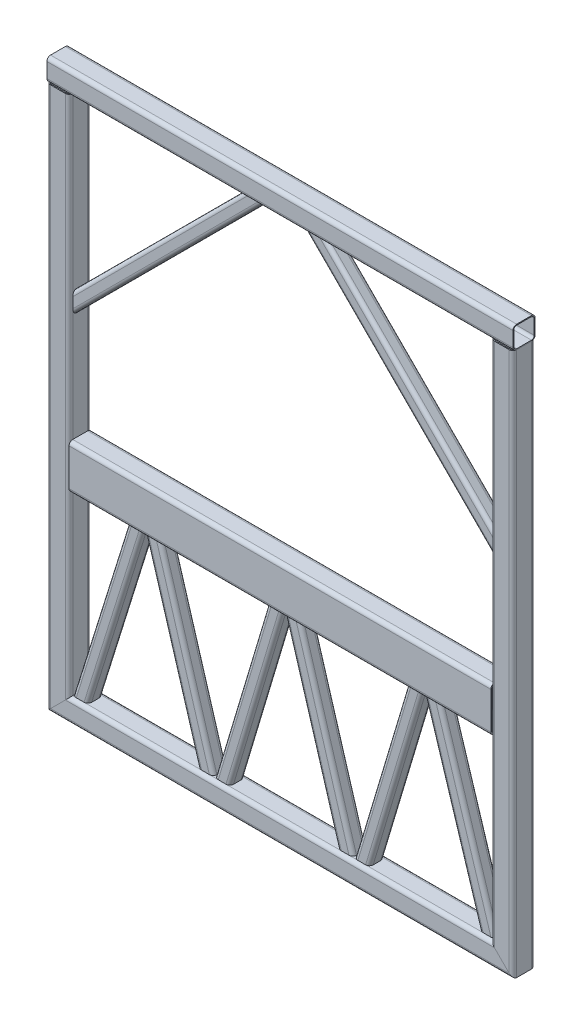
from build123d import *

# Parameters (mm, degrees)
VERTICAL_MEMBERS_DEPTH                 = 1828.8
VERTICAL_MEMBERS_2_DEPTH               = 1828.8
DECK_DEPTH                             = 1524
BOTTOM_DEPTH                           = 1524
TRUSS_1_DEPTH                          = 638.672380803
TRUSS_1_2_DEPTH                        = 638.672380803
TRUSS_2_DEPTH                          = 636.349924496
TRUSS_2_2_DEPTH                        = 636.349924496
TRUSS_3_DEPTH                          = 636.349924496
TRUSS_3_2_DEPTH                        = 636.349924496
TRUSS_TRIM_EXTEND_1_RUN_ON             = 7.9375
TRUSS_TRIM_EXTEND_1_OTHER_END_RUN_ON   = 317.510027
TRUSS_TRIM_EXTEND_2_RUN_ON             = 277.664177
TRUSS_TRIM_EXTEND_2_OTHER_END_RUN_ON   = 30.608782
TRUSS_TRIM_EXTEND_3_RUN_ON             = 168.151073
TRUSS_TRIM_EXTEND_3_OTHER_END_RUN_ON   = 140.121886
TRUSS_TRIM_EXTEND_4_RUN_ON             = 140.121886
TRUSS_TRIM_EXTEND_4_OTHER_END_RUN_ON   = 168.151073
TRUSS_TRIM_EXTEND_5_RUN_ON             = 277.664177
TRUSS_TRIM_EXTEND_5_OTHER_END_RUN_ON   = 30.608782
TRUSS_TRIM_EXTEND_6_RUN_ON             = 317.510026
TRUSS_TRIM_EXTEND_6_OTHER_END_RUN_ON   = 7.9375
BODY_START                             = 1613.273853094
BODY_2_RUN_ON_DEPTH                    = 253.626146906
BODY_START_2                           = 1308.473853094
BODY_4_RUN_ON_DEPTH                    = 253.626146906
PART_START                             = 1613.273853094
PART_RUN_ON_DEPTH                      = 253.626146906
BODY_START_3                           = 215.526146906
BODY_4_RUN_ON_2_DEPTH                  = 253.626146906
STRUCTURAL_MEMBER1_DEPTH               = 1524
BODY_11_RUN_ON_DEPTH                   = 253.626146906
BODY_11_RUN_ON_2_DEPTH                 = 253.626146906
STRUCTURAL_MEMBER2_DEPTH               = 880.065099865
STRUCTURAL_MEMBER2_2_DEPTH             = 880.065099865
TRIM_EXTEND3_EXTEND_1_RUN_ON           = 933.946637
TRIM_EXTEND3_EXTEND_1_OTHER_END_RUN_ON = 691.479721
TRIM_EXTEND4_EXTEND_1_RUN_ON           = 933.946637
TRIM_EXTEND4_EXTEND_1_OTHER_END_RUN_ON = 691.479721


with BuildPart() as part:
    # Sketch111 → Vertical Members (new body)
    with BuildSketch(Plane.XZ.offset(-1828.8)):
        with BuildLine():
            Line((-25.4, -38.1), (25.4, -38.1))
            ThreePointArc((25.4, -38.1), (34.380256121, -34.380256121), (38.1, -25.4))
            Line((38.1, -25.4), (38.1, 25.4))
            ThreePointArc((38.1, 25.4), (34.380256121, 34.380256121), (25.4, 38.1))
            Line((25.4, 38.1), (-25.4, 38.1))
            ThreePointArc((-25.4, 38.1), (-34.380256121, 34.380256121), (-38.1, 25.4))
            Line((-38.1, 25.4), (-38.1, -25.4))
            ThreePointArc((-38.1, -25.4), (-34.380256121, -34.380256121), (-25.4, -38.1))
        make_face()
        with BuildLine():
            Line((-25.4, -34.925), (25.4, -34.925))
            ThreePointArc((25.4, -34.925), (32.135192091, -32.135192091), (34.925, -25.4))
            Line((34.925, -25.4), (34.925, 25.4))
            ThreePointArc((34.925, 25.4), (32.135192091, 32.135192091), (25.4, 34.925))
            Line((25.4, 34.925), (-25.4, 34.925))
            ThreePointArc((-25.4, 34.925), (-32.135192091, 32.135192091), (-34.925, 25.4))
            Line((-34.925, 25.4), (-34.925, -25.4))
            ThreePointArc((-34.925, -25.4), (-32.135192091, -32.135192091), (-25.4, -34.925))
        make_face(mode=Mode.SUBTRACT)
    extrude(amount=VERTICAL_MEMBERS_DEPTH)

    # part cut square before the run-on
    split(bisect_by=Plane(origin=(0, 215.526146906, 0), x_dir=(-1, 0, 0), z_dir=(0, 1, 0)), keep=Keep.TOP)

    # Sketch111 → part run on (add)
    with BuildSketch(Plane.XZ.offset(-1828.8).offset(PART_START)):
        with BuildLine():
            Line((-25.4, -38.1), (25.4, -38.1))
            ThreePointArc((25.4, -38.1), (34.380256121, -34.380256121), (38.1, -25.4))
            Line((38.1, -25.4), (38.1, 25.4))
            ThreePointArc((38.1, 25.4), (34.380256121, 34.380256121), (25.4, 38.1))
            Line((25.4, 38.1), (-25.4, 38.1))
            ThreePointArc((-25.4, 38.1), (-34.380256121, 34.380256121), (-38.1, 25.4))
            Line((-38.1, 25.4), (-38.1, -25.4))
            ThreePointArc((-38.1, -25.4), (-34.380256121, -34.380256121), (-25.4, -38.1))
        make_face()
        with BuildLine():
            Line((-25.4, -34.925), (25.4, -34.925))
            ThreePointArc((25.4, -34.925), (32.135192091, -32.135192091), (34.925, -25.4))
            Line((34.925, -25.4), (34.925, 25.4))
            ThreePointArc((34.925, 25.4), (32.135192091, 32.135192091), (25.4, 34.925))
            Line((25.4, 34.925), (-25.4, 34.925))
            ThreePointArc((-25.4, 34.925), (-32.135192091, 32.135192091), (-34.925, 25.4))
            Line((-34.925, 25.4), (-34.925, -25.4))
            ThreePointArc((-34.925, -25.4), (-32.135192091, -32.135192091), (-25.4, -34.925))
        make_face(mode=Mode.SUBTRACT)
    extrude(amount=PART_RUN_ON_DEPTH)

    # Bottom miter 2
    split(bisect_by=Plane(origin=(0, 0, 0), x_dir=(-0.707106781, -0.707106781, 0), z_dir=(-0.707106781, 0.707106781, 0)), keep=Keep.TOP)


with BuildPart() as body_2:
    # Sketch111 on segment 2 (carried to segment 2) → Vertical Members 2 (new body)
    with BuildSketch(Plane(origin=(1524, 1828.8, 0), x_dir=(1, 0, 0), z_dir=(0, -1, 0))):
        with BuildLine():
            Line((-25.4, -38.1), (25.4, -38.1))
            ThreePointArc((25.4, -38.1), (34.380256121, -34.380256121), (38.1, -25.4))
            Line((38.1, -25.4), (38.1, 25.4))
            ThreePointArc((38.1, 25.4), (34.380256121, 34.380256121), (25.4, 38.1))
            Line((25.4, 38.1), (-25.4, 38.1))
            ThreePointArc((-25.4, 38.1), (-34.380256121, 34.380256121), (-38.1, 25.4))
            Line((-38.1, 25.4), (-38.1, -25.4))
            ThreePointArc((-38.1, -25.4), (-34.380256121, -34.380256121), (-25.4, -38.1))
        make_face()
        with BuildLine():
            Line((-25.4, -34.925), (25.4, -34.925))
            ThreePointArc((25.4, -34.925), (32.135192091, -32.135192091), (34.925, -25.4))
            Line((34.925, -25.4), (34.925, 25.4))
            ThreePointArc((34.925, 25.4), (32.135192091, 32.135192091), (25.4, 34.925))
            Line((25.4, 34.925), (-25.4, 34.925))
            ThreePointArc((-25.4, 34.925), (-32.135192091, 32.135192091), (-34.925, 25.4))
            Line((-34.925, 25.4), (-34.925, -25.4))
            ThreePointArc((-34.925, -25.4), (-32.135192091, -32.135192091), (-25.4, -34.925))
        make_face(mode=Mode.SUBTRACT)
    extrude(amount=VERTICAL_MEMBERS_2_DEPTH)

    # body 2 cut square before the run-on
    split(bisect_by=Plane(origin=(1524, 215.526146906, 0), x_dir=(-1, 0, 0), z_dir=(0, 1, 0)), keep=Keep.TOP)

    # Sketch111 on segment 2 (carried to segment 2) → body 2 run on (add)
    with BuildSketch(Plane(origin=(1524, 1828.8, 0), x_dir=(1, 0, 0), z_dir=(0, -1, 0)).offset(BODY_START)):
        with BuildLine():
            Line((-25.4, -38.1), (25.4, -38.1))
            ThreePointArc((25.4, -38.1), (34.380256121, -34.380256121), (38.1, -25.4))
            Line((38.1, -25.4), (38.1, 25.4))
            ThreePointArc((38.1, 25.4), (34.380256121, 34.380256121), (25.4, 38.1))
            Line((25.4, 38.1), (-25.4, 38.1))
            ThreePointArc((-25.4, 38.1), (-34.380256121, 34.380256121), (-38.1, 25.4))
            Line((-38.1, 25.4), (-38.1, -25.4))
            ThreePointArc((-38.1, -25.4), (-34.380256121, -34.380256121), (-25.4, -38.1))
        make_face()
        with BuildLine():
            Line((-25.4, -34.925), (25.4, -34.925))
            ThreePointArc((25.4, -34.925), (32.135192091, -32.135192091), (34.925, -25.4))
            Line((34.925, -25.4), (34.925, 25.4))
            ThreePointArc((34.925, 25.4), (32.135192091, 32.135192091), (25.4, 34.925))
            Line((25.4, 34.925), (-25.4, 34.925))
            ThreePointArc((-25.4, 34.925), (-32.135192091, 32.135192091), (-34.925, 25.4))
            Line((-34.925, 25.4), (-34.925, -25.4))
            ThreePointArc((-34.925, -25.4), (-32.135192091, -32.135192091), (-25.4, -34.925))
        make_face(mode=Mode.SUBTRACT)
    extrude(amount=BODY_2_RUN_ON_DEPTH)

    # Bottom miter 1
    split(bisect_by=Plane(origin=(1524, 0, 0), x_dir=(-0.707106781, 0.707106781, 0), z_dir=(0.707106781, 0.707106781, 0)), keep=Keep.TOP)


with BuildPart() as body_3:
    # Sketch115 → Deck (new body)
    with BuildSketch(Plane(origin=(0, 723.9, 0), x_dir=(0, 1, 0), z_dir=(1, 0, 0))):
        with BuildLine():
            Line((-63.5, -38.1), (63.5, -38.1))
            ThreePointArc((63.5, -38.1), (72.480256121, -34.380256121), (76.2, -25.4))
            Line((76.2, -25.4), (76.2, 25.4))
            ThreePointArc((76.2, 25.4), (72.480256121, 34.380256121), (63.5, 38.1))
            Line((63.5, 38.1), (-63.5, 38.1))
            ThreePointArc((-63.5, 38.1), (-72.480256121, 34.380256121), (-76.2, 25.4))
            Line((-76.2, 25.4), (-76.2, -25.4))
            ThreePointArc((-76.2, -25.4), (-72.480256121, -34.380256121), (-63.5, -38.1))
        make_face()
        with BuildLine():
            Line((-63.5, -33.3375), (63.5, -33.3375))
            ThreePointArc((63.5, -33.3375), (69.112660076, -31.012660076), (71.4375, -25.4))
            Line((71.4375, -25.4), (71.4375, 25.4))
            ThreePointArc((71.4375, 25.4), (69.112660076, 31.012660076), (63.5, 33.3375))
            Line((63.5, 33.3375), (-63.5, 33.3375))
            ThreePointArc((-63.5, 33.3375), (-69.112660076, 31.012660076), (-71.4375, 25.4))
            Line((-71.4375, 25.4), (-71.4375, -25.4))
            ThreePointArc((-71.4375, -25.4), (-69.112660076, -31.012660076), (-63.5, -33.3375))
        make_face(mode=Mode.SUBTRACT)
    extrude(amount=DECK_DEPTH)

    # Deck trim 43
    split(bisect_by=Plane(origin=(1485.9, 0, 0), x_dir=(0, -1, 0), z_dir=(-1, 0, 0)), keep=Keep.TOP)

    # Deck trim 86
    split(bisect_by=Plane.YZ.offset(38.1), keep=Keep.TOP)


with BuildPart() as body_4:
    # Sketch122 → Bottom (new body)
    with BuildSketch(Plane.YZ):
        with BuildLine():
            Line((-25.4, -38.1), (25.4, -38.1))
            ThreePointArc((25.4, -38.1), (34.380256121, -34.380256121), (38.1, -25.4))
            Line((38.1, -25.4), (38.1, 25.4))
            ThreePointArc((38.1, 25.4), (34.380256121, 34.380256121), (25.4, 38.1))
            Line((25.4, 38.1), (-25.4, 38.1))
            ThreePointArc((-25.4, 38.1), (-34.380256121, 34.380256121), (-38.1, 25.4))
            Line((-38.1, 25.4), (-38.1, -25.4))
            ThreePointArc((-38.1, -25.4), (-34.380256121, -34.380256121), (-25.4, -38.1))
        make_face()
        with BuildLine():
            Line((-25.4, -34.925), (25.4, -34.925))
            ThreePointArc((25.4, -34.925), (32.135192091, -32.135192091), (34.925, -25.4))
            Line((34.925, -25.4), (34.925, 25.4))
            ThreePointArc((34.925, 25.4), (32.135192091, 32.135192091), (25.4, 34.925))
            Line((25.4, 34.925), (-25.4, 34.925))
            ThreePointArc((-25.4, 34.925), (-32.135192091, 32.135192091), (-34.925, 25.4))
            Line((-34.925, 25.4), (-34.925, -25.4))
            ThreePointArc((-34.925, -25.4), (-32.135192091, -32.135192091), (-25.4, -34.925))
        make_face(mode=Mode.SUBTRACT)
    extrude(amount=BOTTOM_DEPTH)

    # body 4 cut square before the run-on
    split(bisect_by=Plane(origin=(1308.473853094, 0, 0), x_dir=(0, -1, 0), z_dir=(-1, 0, 0)), keep=Keep.TOP)

    # Sketch122 → body 4 run on (add)
    with BuildSketch(Plane.YZ.offset(BODY_START_2)):
        with BuildLine():
            Line((-25.4, -38.1), (25.4, -38.1))
            ThreePointArc((25.4, -38.1), (34.380256121, -34.380256121), (38.1, -25.4))
            Line((38.1, -25.4), (38.1, 25.4))
            ThreePointArc((38.1, 25.4), (34.380256121, 34.380256121), (25.4, 38.1))
            Line((25.4, 38.1), (-25.4, 38.1))
            ThreePointArc((-25.4, 38.1), (-34.380256121, 34.380256121), (-38.1, 25.4))
            Line((-38.1, 25.4), (-38.1, -25.4))
            ThreePointArc((-38.1, -25.4), (-34.380256121, -34.380256121), (-25.4, -38.1))
        make_face()
        with BuildLine():
            Line((-25.4, -34.925), (25.4, -34.925))
            ThreePointArc((25.4, -34.925), (32.135192091, -32.135192091), (34.925, -25.4))
            Line((34.925, -25.4), (34.925, 25.4))
            ThreePointArc((34.925, 25.4), (32.135192091, 32.135192091), (25.4, 34.925))
            Line((25.4, 34.925), (-25.4, 34.925))
            ThreePointArc((-25.4, 34.925), (-32.135192091, 32.135192091), (-34.925, 25.4))
            Line((-34.925, 25.4), (-34.925, -25.4))
            ThreePointArc((-34.925, -25.4), (-32.135192091, -32.135192091), (-25.4, -34.925))
        make_face(mode=Mode.SUBTRACT)
    extrude(amount=BODY_4_RUN_ON_DEPTH)

    # Bottom miter 1
    split(bisect_by=Plane(origin=(1524, 0, 0), x_dir=(0.707106781, -0.707106781, 0), z_dir=(-0.707106781, -0.707106781, 0)), keep=Keep.TOP)

    # body 4 cut square before the run-on
    split(bisect_by=Plane.YZ.offset(215.526146906), keep=Keep.TOP)

    # Sketch122 → body 4 run on 2 (add)
    with BuildSketch(Plane.YZ.offset(BODY_START_3)):
        with BuildLine():
            Line((-25.4, -38.1), (25.4, -38.1))
            ThreePointArc((25.4, -38.1), (34.380256121, -34.380256121), (38.1, -25.4))
            Line((38.1, -25.4), (38.1, 25.4))
            ThreePointArc((38.1, 25.4), (34.380256121, 34.380256121), (25.4, 38.1))
            Line((25.4, 38.1), (-25.4, 38.1))
            ThreePointArc((-25.4, 38.1), (-34.380256121, 34.380256121), (-38.1, 25.4))
            Line((-38.1, 25.4), (-38.1, -25.4))
            ThreePointArc((-38.1, -25.4), (-34.380256121, -34.380256121), (-25.4, -38.1))
        make_face()
        with BuildLine():
            Line((-25.4, -34.925), (25.4, -34.925))
            ThreePointArc((25.4, -34.925), (32.135192091, -32.135192091), (34.925, -25.4))
            Line((34.925, -25.4), (34.925, 25.4))
            ThreePointArc((34.925, 25.4), (32.135192091, 32.135192091), (25.4, 34.925))
            Line((25.4, 34.925), (-25.4, 34.925))
            ThreePointArc((-25.4, 34.925), (-32.135192091, 32.135192091), (-34.925, 25.4))
            Line((-34.925, 25.4), (-34.925, -25.4))
            ThreePointArc((-34.925, -25.4), (-32.135192091, -32.135192091), (-25.4, -34.925))
        make_face(mode=Mode.SUBTRACT)
    extrude(amount=-BODY_4_RUN_ON_2_DEPTH)

    # Bottom miter 2
    split(bisect_by=Plane(origin=(0, 0, 0), x_dir=(0.707106781, 0.707106781, 0), z_dir=(0.707106781, -0.707106781, 0)), keep=Keep.TOP)


with BuildPart() as body_5:
    # Sketch114 → Truss 1 (new body)
    with BuildSketch(Plane(origin=(254, 647.7, 0), x_dir=(0.9544799780350298, -0.29827499313594713, 0), z_dir=(-0.29827499313594713, -0.9544799780350298, 0))):
        with BuildLine():
            Line((-12.7, -25.4), (12.7, -25.4))
            ThreePointArc((12.7, -25.4), (21.680256121, -21.680256121), (25.4, -12.7))
            Line((25.4, -12.7), (25.4, 12.7))
            ThreePointArc((25.4, 12.7), (21.680256121, 21.680256121), (12.7, 25.4))
            Line((12.7, 25.4), (-12.7, 25.4))
            ThreePointArc((-12.7, 25.4), (-21.680256121, 21.680256121), (-25.4, 12.7))
            Line((-25.4, 12.7), (-25.4, -12.7))
            ThreePointArc((-25.4, -12.7), (-21.680256121, -21.680256121), (-12.7, -25.4))
        make_face()
        with BuildLine():
            Line((-12.7, -22.225), (12.7, -22.225))
            ThreePointArc((12.7, -22.225), (19.435192091, -19.435192091), (22.225, -12.7))
            Line((22.225, -12.7), (22.225, 12.7))
            ThreePointArc((22.225, 12.7), (19.435192091, 19.435192091), (12.7, 22.225))
            Line((12.7, 22.225), (-12.7, 22.225))
            ThreePointArc((-12.7, 22.225), (-19.435192091, 19.435192091), (-22.225, 12.7))
            Line((-22.225, 12.7), (-22.225, -12.7))
            ThreePointArc((-22.225, -12.7), (-19.435192091, -19.435192091), (-12.7, -22.225))
        make_face(mode=Mode.SUBTRACT)
    extrude(amount=TRUSS_1_DEPTH)

    # Truss Trim extend 1: the member runs on so that the trim can cut it back to the boundary (SolidWorks' 'allow extension')
    extrude(body_5.faces().sort_by_distance((44.104966846, 44.16094786, -20.32))[0], amount=TRUSS_TRIM_EXTEND_1_RUN_ON, dir=(-0.298274993, -0.954479978, 0))

    # Truss Trim extend 1 other end: the member runs on so that the trim can cut it back to the boundary (SolidWorks' 'allow extension')
    extrude(body_5.faces().sort_by_distance((234.604966846, 653.760947861, -20.32))[0], amount=TRUSS_TRIM_EXTEND_1_OTHER_END_RUN_ON, dir=(0.298274993, 0.954479978, 0))

    # Truss Trim
    split(bisect_by=Plane(origin=(762, 647.7, 0), x_dir=(1, 0, 0), z_dir=(0, -1, 0)), keep=Keep.TOP)

    # Truss Trim 3
    split(bisect_by=Plane(origin=(762, 38.1, 0), x_dir=(-1, 0, 0), z_dir=(0, 1, 0)), keep=Keep.TOP)


with BuildPart() as body_6:
    # Sketch114 on segment 2 (carried to segment 2) → Truss 1 2 (new body)
    with BuildSketch(Plane(origin=(1460.5, 38.1, 0), x_dir=(-0.954479978, -0.298274993, 0), z_dir=(-0.298274993, 0.954479978, 0))):
        with BuildLine():
            Line((-12.7, -25.4), (12.7, -25.4))
            ThreePointArc((12.7, -25.4), (21.680256121, -21.680256121), (25.4, -12.7))
            Line((25.4, -12.7), (25.4, 12.7))
            ThreePointArc((25.4, 12.7), (21.680256121, 21.680256121), (12.7, 25.4))
            Line((12.7, 25.4), (-12.7, 25.4))
            ThreePointArc((-12.7, 25.4), (-21.680256121, 21.680256121), (-25.4, 12.7))
            Line((-25.4, 12.7), (-25.4, -12.7))
            ThreePointArc((-25.4, -12.7), (-21.680256121, -21.680256121), (-12.7, -25.4))
        make_face()
        with BuildLine():
            Line((-12.7, -22.225), (12.7, -22.225))
            ThreePointArc((12.7, -22.225), (19.435192091, -19.435192091), (22.225, -12.7))
            Line((22.225, -12.7), (22.225, 12.7))
            ThreePointArc((22.225, 12.7), (19.435192091, 19.435192091), (12.7, 22.225))
            Line((12.7, 22.225), (-12.7, 22.225))
            ThreePointArc((-12.7, 22.225), (-19.435192091, 19.435192091), (-22.225, 12.7))
            Line((-22.225, 12.7), (-22.225, -12.7))
            ThreePointArc((-22.225, -12.7), (-19.435192091, -19.435192091), (-12.7, -22.225))
        make_face(mode=Mode.SUBTRACT)
    extrude(amount=TRUSS_1_2_DEPTH)

    # Truss Trim extend 6: the member runs on so that the trim can cut it back to the boundary (SolidWorks' 'allow extension')
    extrude(body_6.faces().sort_by_distance((1289.395033227, 653.760947881, -20.32))[0], amount=TRUSS_TRIM_EXTEND_6_RUN_ON, dir=(-0.298274993, 0.954479978, 0))

    # Truss Trim extend 6 other end: the member runs on so that the trim can cut it back to the boundary (SolidWorks' 'allow extension')
    extrude(body_6.faces().sort_by_distance((1479.895033154, 44.160947858, -20.32))[0], amount=TRUSS_TRIM_EXTEND_6_OTHER_END_RUN_ON, dir=(0.298274993, -0.954479978, 0))

    # Truss Trim
    split(bisect_by=Plane(origin=(762, 647.7, 0), x_dir=(1, 0, 0), z_dir=(0, -1, 0)), keep=Keep.TOP)

    # Truss Trim 3
    split(bisect_by=Plane(origin=(762, 38.1, 0), x_dir=(-1, 0, 0), z_dir=(0, 1, 0)), keep=Keep.TOP)


with BuildPart() as body_7:
    # Sketch118 → Truss 2 (new body)
    with BuildSketch(Plane(origin=(311.15, 647.7, 0), x_dir=(0.9579634985934418, 0.2868901102558484, 0), z_dir=(0.2868901102558484, -0.9579634985934419, 0))):
        with BuildLine():
            Line((-12.7, -25.4), (12.7, -25.4))
            ThreePointArc((12.7, -25.4), (21.680256121, -21.680256121), (25.4, -12.7))
            Line((25.4, -12.7), (25.4, 12.7))
            ThreePointArc((25.4, 12.7), (21.680256121, 21.680256121), (12.7, 25.4))
            Line((12.7, 25.4), (-12.7, 25.4))
            ThreePointArc((-12.7, 25.4), (-21.680256121, 21.680256121), (-25.4, 12.7))
            Line((-25.4, 12.7), (-25.4, -12.7))
            ThreePointArc((-25.4, -12.7), (-21.680256121, -21.680256121), (-12.7, -25.4))
        make_face()
        with BuildLine():
            Line((-12.7, -22.225), (12.7, -22.225))
            ThreePointArc((12.7, -22.225), (19.435192091, -19.435192091), (22.225, -12.7))
            Line((22.225, -12.7), (22.225, 12.7))
            ThreePointArc((22.225, 12.7), (19.435192091, 19.435192091), (12.7, 22.225))
            Line((12.7, 22.225), (-12.7, 22.225))
            ThreePointArc((-12.7, 22.225), (-19.435192091, 19.435192091), (-22.225, 12.7))
            Line((-22.225, 12.7), (-22.225, -12.7))
            ThreePointArc((-22.225, -12.7), (-19.435192091, -19.435192091), (-12.7, -22.225))
        make_face(mode=Mode.SUBTRACT)
    extrude(amount=TRUSS_2_DEPTH)

    # Truss Trim extend 2: the member runs on so that the trim can cut it back to the boundary (SolidWorks' 'allow extension')
    extrude(body_7.faces().sort_by_distance((474.246681709, 32.27039296, -20.32))[0], amount=TRUSS_TRIM_EXTEND_2_RUN_ON, dir=(0.28689011, -0.957963499, 0))

    # Truss Trim extend 2 other end: the member runs on so that the trim can cut it back to the boundary (SolidWorks' 'allow extension')
    extrude(body_7.faces().sort_by_distance((291.684181709, 641.87039296, -20.32))[0], amount=TRUSS_TRIM_EXTEND_2_OTHER_END_RUN_ON, dir=(-0.28689011, 0.957963499, 0))

    # Truss Trim
    split(bisect_by=Plane(origin=(762, 647.7, 0), x_dir=(1, 0, 0), z_dir=(0, -1, 0)), keep=Keep.TOP)

    # Truss Trim 3
    split(bisect_by=Plane(origin=(762, 38.1, 0), x_dir=(-1, 0, 0), z_dir=(0, 1, 0)), keep=Keep.TOP)


with BuildPart() as body_8:
    # Sketch118 on segment 2 (carried to segment 2) → Truss 2 2 (new body)
    with BuildSketch(Plane(origin=(1212.85, 647.7, 0), x_dir=(0.957963499, -0.28689011, 0), z_dir=(-0.28689011, -0.957963499, 0))):
        with BuildLine():
            Line((-12.7, -25.4), (12.7, -25.4))
            ThreePointArc((12.7, -25.4), (21.680256121, -21.680256121), (25.4, -12.7))
            Line((25.4, -12.7), (25.4, 12.7))
            ThreePointArc((25.4, 12.7), (21.680256121, 21.680256121), (12.7, 25.4))
            Line((12.7, 25.4), (-12.7, 25.4))
            ThreePointArc((-12.7, 25.4), (-21.680256121, 21.680256121), (-25.4, 12.7))
            Line((-25.4, 12.7), (-25.4, -12.7))
            ThreePointArc((-25.4, -12.7), (-21.680256121, -21.680256121), (-12.7, -25.4))
        make_face()
        with BuildLine():
            Line((-12.7, -22.225), (12.7, -22.225))
            ThreePointArc((12.7, -22.225), (19.435192091, -19.435192091), (22.225, -12.7))
            Line((22.225, -12.7), (22.225, 12.7))
            ThreePointArc((22.225, 12.7), (19.435192091, 19.435192091), (12.7, 22.225))
            Line((12.7, 22.225), (-12.7, 22.225))
            ThreePointArc((-12.7, 22.225), (-19.435192091, 19.435192091), (-22.225, 12.7))
            Line((-22.225, 12.7), (-22.225, -12.7))
            ThreePointArc((-22.225, -12.7), (-19.435192091, -19.435192091), (-12.7, -22.225))
        make_face(mode=Mode.SUBTRACT)
    extrude(amount=TRUSS_2_2_DEPTH)

    # Truss Trim extend 5: the member runs on so that the trim can cut it back to the boundary (SolidWorks' 'allow extension')
    extrude(body_8.faces().sort_by_distance((1010.821681927, 43.929606967, -20.32))[0], amount=TRUSS_TRIM_EXTEND_5_RUN_ON, dir=(-0.28689011, -0.957963499, 0))

    # Truss Trim extend 5 other end: the member runs on so that the trim can cut it back to the boundary (SolidWorks' 'allow extension')
    extrude(body_8.faces().sort_by_distance((1193.384181706, 653.529607033, -20.32))[0], amount=TRUSS_TRIM_EXTEND_5_OTHER_END_RUN_ON, dir=(0.28689011, 0.957963499, 0))

    # Truss Trim
    split(bisect_by=Plane(origin=(762, 647.7, 0), x_dir=(1, 0, 0), z_dir=(0, -1, 0)), keep=Keep.TOP)

    # Truss Trim 3
    split(bisect_by=Plane(origin=(762, 38.1, 0), x_dir=(-1, 0, 0), z_dir=(0, 1, 0)), keep=Keep.TOP)


with BuildPart() as body_9:
    # Sketch119 → Truss 3 (new body)
    with BuildSketch(Plane(origin=(550.8625, 38.1, 0), x_dir=(-0.9579634985934418, 0.28689011025584843, 0), z_dir=(0.28689011025584843, 0.9579634985934418, 0))):
        with BuildLine():
            Line((-12.7, -25.4), (12.7, -25.4))
            ThreePointArc((12.7, -25.4), (21.680256121, -21.680256121), (25.4, -12.7))
            Line((25.4, -12.7), (25.4, 12.7))
            ThreePointArc((25.4, 12.7), (21.680256121, 21.680256121), (12.7, 25.4))
            Line((12.7, 25.4), (-12.7, 25.4))
            ThreePointArc((-12.7, 25.4), (-21.680256121, 21.680256121), (-25.4, 12.7))
            Line((-25.4, 12.7), (-25.4, -12.7))
            ThreePointArc((-25.4, -12.7), (-21.680256121, -21.680256121), (-12.7, -25.4))
        make_face()
        with BuildLine():
            Line((-12.7, -22.225), (12.7, -22.225))
            ThreePointArc((12.7, -22.225), (19.435192091, -19.435192091), (22.225, -12.7))
            Line((22.225, -12.7), (22.225, 12.7))
            ThreePointArc((22.225, 12.7), (19.435192091, 19.435192091), (12.7, 22.225))
            Line((12.7, 22.225), (-12.7, 22.225))
            ThreePointArc((-12.7, 22.225), (-19.435192091, 19.435192091), (-22.225, 12.7))
            Line((-22.225, 12.7), (-22.225, -12.7))
            ThreePointArc((-22.225, -12.7), (-19.435192091, -19.435192091), (-12.7, -22.225))
        make_face(mode=Mode.SUBTRACT)
    extrude(amount=TRUSS_3_DEPTH)

    # Truss Trim extend 3: the member runs on so that the trim can cut it back to the boundary (SolidWorks' 'allow extension')
    extrude(body_9.faces().sort_by_distance((752.890818291, 641.870392959, -20.32))[0], amount=TRUSS_TRIM_EXTEND_3_RUN_ON, dir=(0.28689011, 0.957963499, 0))

    # Truss Trim extend 3 other end: the member runs on so that the trim can cut it back to the boundary (SolidWorks' 'allow extension')
    extrude(body_9.faces().sort_by_distance((570.328318291, 32.27039296, -20.32))[0], amount=TRUSS_TRIM_EXTEND_3_OTHER_END_RUN_ON, dir=(-0.28689011, -0.957963499, 0))

    # Truss Trim
    split(bisect_by=Plane(origin=(762, 647.7, 0), x_dir=(1, 0, 0), z_dir=(0, -1, 0)), keep=Keep.TOP)

    # Truss Trim 3
    split(bisect_by=Plane(origin=(762, 38.1, 0), x_dir=(-1, 0, 0), z_dir=(0, 1, 0)), keep=Keep.TOP)


with BuildPart() as body_10:
    # Sketch119 on segment 2 (carried to segment 2) → Truss 3 2 (new body)
    with BuildSketch(Plane(origin=(790.575, 647.7, 0), x_dir=(0.957963499, 0.28689011, 0), z_dir=(0.28689011, -0.957963499, 0))):
        with BuildLine():
            Line((-12.7, -25.4), (12.7, -25.4))
            ThreePointArc((12.7, -25.4), (21.680256121, -21.680256121), (25.4, -12.7))
            Line((25.4, -12.7), (25.4, 12.7))
            ThreePointArc((25.4, 12.7), (21.680256121, 21.680256121), (12.7, 25.4))
            Line((12.7, 25.4), (-12.7, 25.4))
            ThreePointArc((-12.7, 25.4), (-21.680256121, 21.680256121), (-25.4, 12.7))
            Line((-25.4, 12.7), (-25.4, -12.7))
            ThreePointArc((-25.4, -12.7), (-21.680256121, -21.680256121), (-12.7, -25.4))
        make_face()
        with BuildLine():
            Line((-12.7, -22.225), (12.7, -22.225))
            ThreePointArc((12.7, -22.225), (19.435192091, -19.435192091), (22.225, -12.7))
            Line((22.225, -12.7), (22.225, 12.7))
            ThreePointArc((22.225, 12.7), (19.435192091, 19.435192091), (12.7, 22.225))
            Line((12.7, 22.225), (-12.7, 22.225))
            ThreePointArc((-12.7, 22.225), (-19.435192091, 19.435192091), (-22.225, 12.7))
            Line((-22.225, 12.7), (-22.225, -12.7))
            ThreePointArc((-22.225, -12.7), (-19.435192091, -19.435192091), (-12.7, -22.225))
        make_face(mode=Mode.SUBTRACT)
    extrude(amount=TRUSS_3_2_DEPTH)

    # Truss Trim extend 4: the member runs on so that the trim can cut it back to the boundary (SolidWorks' 'allow extension')
    extrude(body_10.faces().sort_by_distance((953.671681486, 32.270392901, -20.32))[0], amount=TRUSS_TRIM_EXTEND_4_RUN_ON, dir=(0.28689011, -0.957963499, 0))

    # Truss Trim extend 4 other end: the member runs on so that the trim can cut it back to the boundary (SolidWorks' 'allow extension')
    extrude(body_10.faces().sort_by_distance((771.109181706, 641.870392967, -20.32))[0], amount=TRUSS_TRIM_EXTEND_4_OTHER_END_RUN_ON, dir=(-0.28689011, 0.957963499, 0))

    # Truss Trim
    split(bisect_by=Plane(origin=(762, 647.7, 0), x_dir=(1, 0, 0), z_dir=(0, -1, 0)), keep=Keep.TOP)

    # Truss Trim 3
    split(bisect_by=Plane(origin=(762, 38.1, 0), x_dir=(-1, 0, 0), z_dir=(0, 1, 0)), keep=Keep.TOP)


with BuildPart() as body_11:
    # Sketch128 → Structural Member1 (new body)
    with BuildSketch(Plane(origin=(0, 1866.9, 0), x_dir=(0, 1, 0), z_dir=(1, 0, 0))):
        with BuildLine():
            Line((-25.4, -38.1), (25.4, -38.1))
            ThreePointArc((25.4, -38.1), (34.380256121, -34.380256121), (38.1, -25.4))
            Line((38.1, -25.4), (38.1, 25.4))
            ThreePointArc((38.1, 25.4), (34.380256121, 34.380256121), (25.4, 38.1))
            Line((25.4, 38.1), (-25.4, 38.1))
            ThreePointArc((-25.4, 38.1), (-34.380256121, 34.380256121), (-38.1, 25.4))
            Line((-38.1, 25.4), (-38.1, -25.4))
            ThreePointArc((-38.1, -25.4), (-34.380256121, -34.380256121), (-25.4, -38.1))
        make_face()
        with BuildLine():
            Line((-25.4, -34.925), (25.4, -34.925))
            ThreePointArc((25.4, -34.925), (32.135192091, -32.135192091), (34.925, -25.4))
            Line((34.925, -25.4), (34.925, 25.4))
            ThreePointArc((34.925, 25.4), (32.135192091, 32.135192091), (25.4, 34.925))
            Line((25.4, 34.925), (-25.4, 34.925))
            ThreePointArc((-25.4, 34.925), (-32.135192091, 32.135192091), (-34.925, 25.4))
            Line((-34.925, 25.4), (-34.925, -25.4))
            ThreePointArc((-34.925, -25.4), (-32.135192091, -32.135192091), (-25.4, -34.925))
        make_face(mode=Mode.SUBTRACT)
    extrude(amount=STRUCTURAL_MEMBER1_DEPTH)

    # body 11 cut square before the run-on
    split(bisect_by=Plane(origin=(215.526146906, 1866.9, 0), x_dir=(0, 1, 0), z_dir=(1, 0, 0)), keep=Keep.TOP)

    # Sketch128 → body 11 run on (add)
    with BuildSketch(Plane(origin=(0, 1866.9, 0), x_dir=(0, 1, 0), z_dir=(1, 0, 0)).offset(BODY_START_3)):
        with BuildLine():
            Line((-25.4, -38.1), (25.4, -38.1))
            ThreePointArc((25.4, -38.1), (34.380256121, -34.380256121), (38.1, -25.4))
            Line((38.1, -25.4), (38.1, 25.4))
            ThreePointArc((38.1, 25.4), (34.380256121, 34.380256121), (25.4, 38.1))
            Line((25.4, 38.1), (-25.4, 38.1))
            ThreePointArc((-25.4, 38.1), (-34.380256121, 34.380256121), (-38.1, 25.4))
            Line((-38.1, 25.4), (-38.1, -25.4))
            ThreePointArc((-38.1, -25.4), (-34.380256121, -34.380256121), (-25.4, -38.1))
        make_face()
        with BuildLine():
            Line((-25.4, -34.925), (25.4, -34.925))
            ThreePointArc((25.4, -34.925), (32.135192091, -32.135192091), (34.925, -25.4))
            Line((34.925, -25.4), (34.925, 25.4))
            ThreePointArc((34.925, 25.4), (32.135192091, 32.135192091), (25.4, 34.925))
            Line((25.4, 34.925), (-25.4, 34.925))
            ThreePointArc((-25.4, 34.925), (-32.135192091, 32.135192091), (-34.925, 25.4))
            Line((-34.925, 25.4), (-34.925, -25.4))
            ThreePointArc((-34.925, -25.4), (-32.135192091, -32.135192091), (-25.4, -34.925))
        make_face(mode=Mode.SUBTRACT)
    extrude(amount=-BODY_11_RUN_ON_DEPTH)

    # body 11 cut square before the run-on
    split(bisect_by=Plane(origin=(1308.473853094, 1866.9, 0), x_dir=(0, -1, 0), z_dir=(-1, 0, 0)), keep=Keep.TOP)

    # Sketch128 → body 11 run on 2 (add)
    with BuildSketch(Plane(origin=(0, 1866.9, 0), x_dir=(0, 1, 0), z_dir=(1, 0, 0)).offset(BODY_START_2)):
        with BuildLine():
            Line((-25.4, -38.1), (25.4, -38.1))
            ThreePointArc((25.4, -38.1), (34.380256121, -34.380256121), (38.1, -25.4))
            Line((38.1, -25.4), (38.1, 25.4))
            ThreePointArc((38.1, 25.4), (34.380256121, 34.380256121), (25.4, 38.1))
            Line((25.4, 38.1), (-25.4, 38.1))
            ThreePointArc((-25.4, 38.1), (-34.380256121, 34.380256121), (-38.1, 25.4))
            Line((-38.1, 25.4), (-38.1, -25.4))
            ThreePointArc((-38.1, -25.4), (-34.380256121, -34.380256121), (-25.4, -38.1))
        make_face()
        with BuildLine():
            Line((-25.4, -34.925), (25.4, -34.925))
            ThreePointArc((25.4, -34.925), (32.135192091, -32.135192091), (34.925, -25.4))
            Line((34.925, -25.4), (34.925, 25.4))
            ThreePointArc((34.925, 25.4), (32.135192091, 32.135192091), (25.4, 34.925))
            Line((25.4, 34.925), (-25.4, 34.925))
            ThreePointArc((-25.4, 34.925), (-32.135192091, 32.135192091), (-34.925, 25.4))
            Line((-34.925, 25.4), (-34.925, -25.4))
            ThreePointArc((-34.925, -25.4), (-32.135192091, -32.135192091), (-25.4, -34.925))
        make_face(mode=Mode.SUBTRACT)
    extrude(amount=BODY_11_RUN_ON_2_DEPTH)


with BuildPart() as body_12:
    # Sketch131 → Structural Member2 (new body)
    with BuildSketch(Plane(origin=(660.4, 1828.8, 0), x_dir=(0.7071067811865516, -0.7071067811865436, 0), z_dir=(-0.7071067811865436, -0.7071067811865516, 0))):
        with BuildLine():
            Line((-12.7, -25.4), (12.7, -25.4))
            ThreePointArc((12.7, -25.4), (21.680256121, -21.680256121), (25.4, -12.7))
            Line((25.4, -12.7), (25.4, 12.7))
            ThreePointArc((25.4, 12.7), (21.680256121, 21.680256121), (12.7, 25.4))
            Line((12.7, 25.4), (-12.7, 25.4))
            ThreePointArc((-12.7, 25.4), (-21.680256121, 21.680256121), (-25.4, 12.7))
            Line((-25.4, 12.7), (-25.4, -12.7))
            ThreePointArc((-25.4, -12.7), (-21.680256121, -21.680256121), (-12.7, -25.4))
        make_face()
        with BuildLine():
            Line((-12.7, -19.05), (12.7, -19.05))
            ThreePointArc((12.7, -19.05), (17.190128061, -17.190128061), (19.05, -12.7))
            Line((19.05, -12.7), (19.05, 12.7))
            ThreePointArc((19.05, 12.7), (17.190128061, 17.190128061), (12.7, 19.05))
            Line((12.7, 19.05), (-12.7, 19.05))
            ThreePointArc((-12.7, 19.05), (-17.190128061, 17.190128061), (-19.05, 12.7))
            Line((-19.05, 12.7), (-19.05, -12.7))
            ThreePointArc((-19.05, -12.7), (-17.190128061, -17.190128061), (-12.7, -19.05))
        make_face(mode=Mode.SUBTRACT)
    extrude(amount=STRUCTURAL_MEMBER2_DEPTH)

    # Trim/Extend4 extend 1: the member runs on so that the trim can cut it back to the boundary (SolidWorks' 'allow extension')
    extrude(body_12.faces().sort_by_distance((38.1, 1206.5, -20.32))[0], amount=TRIM_EXTEND4_EXTEND_1_RUN_ON, dir=(-0.707106781, -0.707106781, 0))

    # Trim/Extend4 extend 1 other end: the member runs on so that the trim can cut it back to the boundary (SolidWorks' 'allow extension')
    extrude(body_12.faces().sort_by_distance((660.4, 1828.8, -20.32))[0], amount=TRIM_EXTEND4_EXTEND_1_OTHER_END_RUN_ON, dir=(0.707106781, 0.707106781, 0))

    # Trim_Extend4 9
    split(bisect_by=Plane(origin=(762, 1828.8, 0), x_dir=(1, 0, 0), z_dir=(0, -1, 0)), keep=Keep.TOP)

    # Trim_Extend4 60
    split(bisect_by=Plane(origin=(38.1, 933.45, 0), x_dir=(0, 1, 0), z_dir=(1, 0, 0)), keep=Keep.TOP)


with BuildPart() as body_13:
    # Sketch131 on segment 2 (carried to segment 2) → Structural Member2 2 (new body)
    with BuildSketch(Plane(origin=(863.6, 1828.8, 0), x_dir=(0.707106781, 0.707106781, 0), z_dir=(0.707106781, -0.707106781, 0))):
        with BuildLine():
            Line((-12.7, -25.4), (12.7, -25.4))
            ThreePointArc((12.7, -25.4), (21.680256121, -21.680256121), (25.4, -12.7))
            Line((25.4, -12.7), (25.4, 12.7))
            ThreePointArc((25.4, 12.7), (21.680256121, 21.680256121), (12.7, 25.4))
            Line((12.7, 25.4), (-12.7, 25.4))
            ThreePointArc((-12.7, 25.4), (-21.680256121, 21.680256121), (-25.4, 12.7))
            Line((-25.4, 12.7), (-25.4, -12.7))
            ThreePointArc((-25.4, -12.7), (-21.680256121, -21.680256121), (-12.7, -25.4))
        make_face()
        with BuildLine():
            Line((-12.7, -19.05), (12.7, -19.05))
            ThreePointArc((12.7, -19.05), (17.190128061, -17.190128061), (19.05, -12.7))
            Line((19.05, -12.7), (19.05, 12.7))
            ThreePointArc((19.05, 12.7), (17.190128061, 17.190128061), (12.7, 19.05))
            Line((12.7, 19.05), (-12.7, 19.05))
            ThreePointArc((-12.7, 19.05), (-17.190128061, 17.190128061), (-19.05, 12.7))
            Line((-19.05, 12.7), (-19.05, -12.7))
            ThreePointArc((-19.05, -12.7), (-17.190128061, -17.190128061), (-12.7, -19.05))
        make_face(mode=Mode.SUBTRACT)
    extrude(amount=STRUCTURAL_MEMBER2_2_DEPTH)

    # Trim/Extend3 extend 1: the member runs on so that the trim can cut it back to the boundary (SolidWorks' 'allow extension')
    extrude(body_13.faces().sort_by_distance((1485.9, 1206.5, -20.32))[0], amount=TRIM_EXTEND3_EXTEND_1_RUN_ON, dir=(0.707106781, -0.707106781, 0))

    # Trim/Extend3 extend 1 other end: the member runs on so that the trim can cut it back to the boundary (SolidWorks' 'allow extension')
    extrude(body_13.faces().sort_by_distance((863.6, 1828.8, -20.32))[0], amount=TRIM_EXTEND3_EXTEND_1_OTHER_END_RUN_ON, dir=(-0.707106781, 0.707106781, 0))

    # Trim_Extend3 9
    split(bisect_by=Plane(origin=(762, 1828.8, 0), x_dir=(1, 0, 0), z_dir=(0, -1, 0)), keep=Keep.TOP)

    # Trim_Extend3 60
    split(bisect_by=Plane(origin=(1485.9, 933.45, 0), x_dir=(0, -1, 0), z_dir=(-1, 0, 0)), keep=Keep.TOP)


solid = Compound([part.part, body_2.part, body_3.part, body_4.part, body_5.part, body_6.part, body_7.part, body_8.part, body_9.part, body_10.part, body_11.part, body_12.part, body_13.part])
